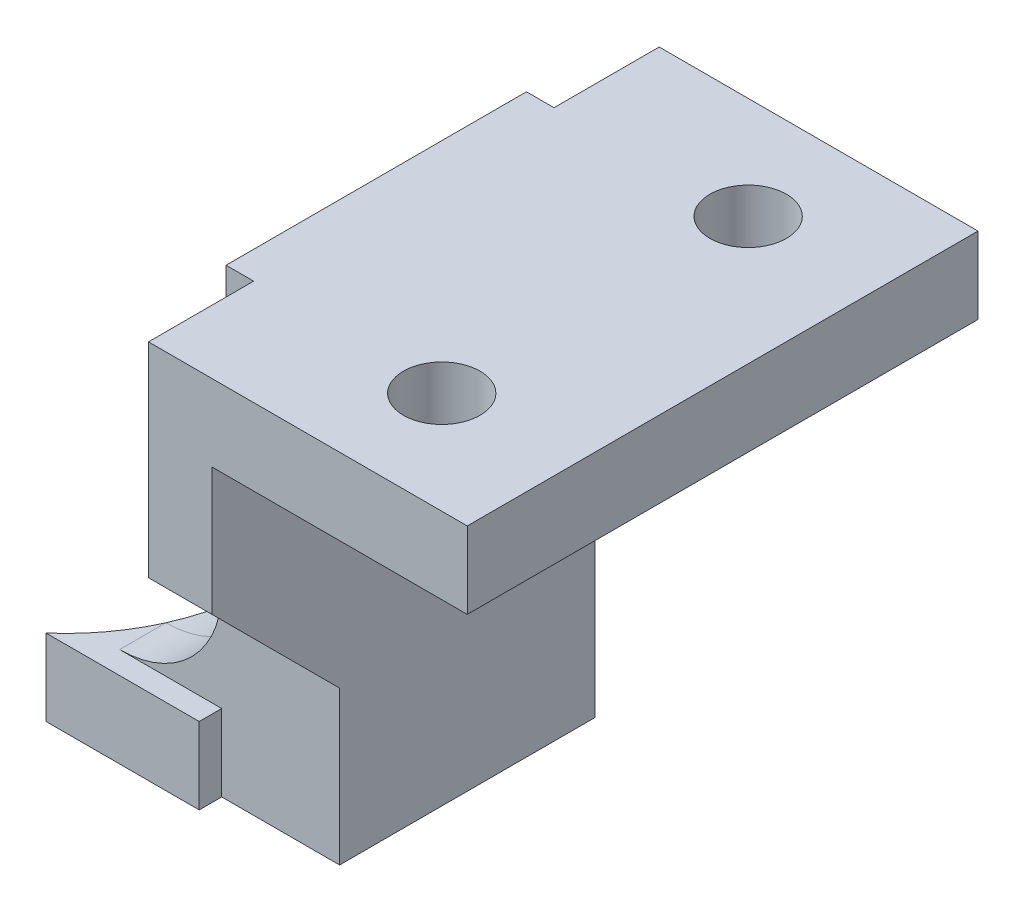
from build123d import *

# Parameters (mm, degrees)
SKETCH1_R               = 1.5
BOSS_EXTRUDE1_DEPTH     = 3
SKETCH3_W               = 4.615398666
SKETCH3_H               = 10
BOSS_EXTRUDE2_DEPTH     = 12.9997796
FILLET7_R               = 1
CUT_EXTRUDE4_DEPTH      = 10
SKETCH9_W               = 13.564457496
SKETCH9_H               = 20
SKETCH9_R               = 1.5
BOSS_EXTRUDE3_DEPTH     = 3
CHAMFER1_SIZE           = 10
CHAMFER2_SIZE           = 10
FILLET8_R               = 4
CUT_EXTRUDE5_DEPTH      = 27.355587635
CUT_EXTRUDE5_DEPTH_BACK = 27.355587635
SKETCH10_W              = 8.131195533
SKETCH10_H              = 6.749631571
SKETCH10_H_2            = 7.013496214


with BuildPart() as part:
    # Sketch1 → Boss-Extrude1 (new body)
    with BuildSketch(Plane(origin=(0, 0, 0), x_dir=(1, 0, 0), z_dir=(0, 1, 0))):
        Polygon((-3, -11.32792047), (3, -11.32792047), (3, -5), (7.615398666, -5), (7.615398666, 5), (3, 5), (3, 11.32792047), (-3, 11.32792047), align=None)
        with Locations(Location((0, 8.5, 0), (0, 0, 270))):
            Circle(SKETCH1_R, mode=Mode.SUBTRACT)
        with Locations(Location((0, -8.5, 0), (0, 0, 270))):
            Circle(SKETCH1_R, mode=Mode.SUBTRACT)
    extrude(amount=BOSS_EXTRUDE1_DEPTH)

    # Sketch3 → Boss-Extrude2 (add)
    with BuildSketch(Plane(origin=(0, 3, 0), x_dir=(1, 0, 0), z_dir=(0, 1, 0))):
        with Locations((5.307699333, 0)):
            Rectangle(SKETCH3_W, SKETCH3_H)
    extrude(amount=BOSS_EXTRUDE2_DEPTH)

    # Fillet7
    fillet7_edges = [part.edges().sort_by_distance(p)[0] for p in [
        (3, 1.5, 11.32792047),
        (3, 1.5, -11.32792047),
    ]]
    fillet(fillet7_edges, radius=FILLET7_R)

    # Sketch7 → Cut-Extrude4 (cut)
    with BuildSketch(Plane.XZ):
        with BuildLine():
            Line((-3.65526474, -6.392053518), (-3.78188192, 6.478485425))
            ThreePointArc((-3.78188192, 6.478485425), (-0.319780446, 0.076652438), (-3.65526474, -6.392053518))
        make_face()
    extrude(amount=-CUT_EXTRUDE4_DEPTH, mode=Mode.SUBTRACT)

    # Sketch9 → Boss-Extrude3 (add)
    with BuildSketch(Plane(origin=(0, 15.9997796, 0), x_dir=(1, 0, 0), z_dir=(0, 1, 0))):
        with Locations((10.833169918, 0)):
            Rectangle(SKETCH9_W, SKETCH9_H)
        with Locations(Location((12.615398666, 6, 0), (0, 0, 270))):
            Circle(SKETCH9_R, mode=Mode.SUBTRACT)
        with Locations(Location((12.615398666, -6, 0), (0, 0, 270))):
            Circle(SKETCH9_R, mode=Mode.SUBTRACT)
    extrude(amount=BOSS_EXTRUDE3_DEPTH)

    # Chamfer1
    # the kernel refuses this chamfer: 10 mm, written as the material it adds along each edge
    with BuildSketch(Plane(origin=(4.05094117, 15.9997796, 5), x_dir=(0, -0.9996219169112968, -0.027495876610586403), z_dir=(1, 0, 0))) as chamfer1_piece_1_section:
        Polygon((CHAMFER1_SIZE * 0.999621916911, -CHAMFER1_SIZE * 0.0274958766106), (-CHAMFER1_SIZE * 0.0274958766106, -CHAMFER1_SIZE * 0.999621916911), (0, 0), align=None)
    chamfer1_piece_1 = extrude(amount=3.564457497, mode=Mode.PRIVATE)
    chamfer1_piece_1 = split(chamfer1_piece_1, bisect_by=Plane(origin=(5.833169918, 12.110890711, 10), z_dir=(0, 0, -1)), keep=Keep.TOP, mode=Mode.PRIVATE)
    add(chamfer1_piece_1)

    # Chamfer2
    # the kernel refuses this chamfer: 10 mm, written as the material it adds along each edge
    with BuildSketch(Plane(origin=(7.615398666, 15.9997796, -5), x_dir=(0, -0.9996219169112968, 0.027495876610586403), z_dir=(-1, 0, 0))) as chamfer2_piece_1_section:
        Polygon((CHAMFER2_SIZE * 0.999621916911, -CHAMFER2_SIZE * 0.0274958766106), (-CHAMFER2_SIZE * 0.0274958766106, -CHAMFER2_SIZE * 0.999621916911), (0, 0), align=None)
    chamfer2_piece_1 = extrude(amount=3.564457497, mode=Mode.PRIVATE)
    chamfer2_piece_1 = split(chamfer2_piece_1, bisect_by=Plane(origin=(5.833169918, 12.110890711, -10), z_dir=(0, 0, 1)), keep=Keep.TOP, mode=Mode.PRIVATE)
    add(chamfer2_piece_1)

    # Fillet8
    fillet8_edges = [part.edges().sort_by_distance(p)[0] for p in [
        (3, 3, 0),
    ]]
    fillet(fillet8_edges, radius=FILLET8_R)

    # Sketch10 → Cut-Extrude5 (cut, two sides: drawn at the far end of the back side and taken through both)
    with BuildSketch(Plane(origin=(0, 3, 0), x_dir=(1, 0, 0), z_dir=(0, 1, 0)).offset(-CUT_EXTRUDE5_DEPTH_BACK)):
        with Locations((1.065597767, 9.256059268)):
            Rectangle(SKETCH10_W, SKETCH10_H)
        with Locations((1.065597767, -9.38799159)):
            Rectangle(SKETCH10_W, SKETCH10_H_2)
    extrude(amount=CUT_EXTRUDE5_DEPTH + CUT_EXTRUDE5_DEPTH_BACK, mode=Mode.SUBTRACT)


solid = part.part
